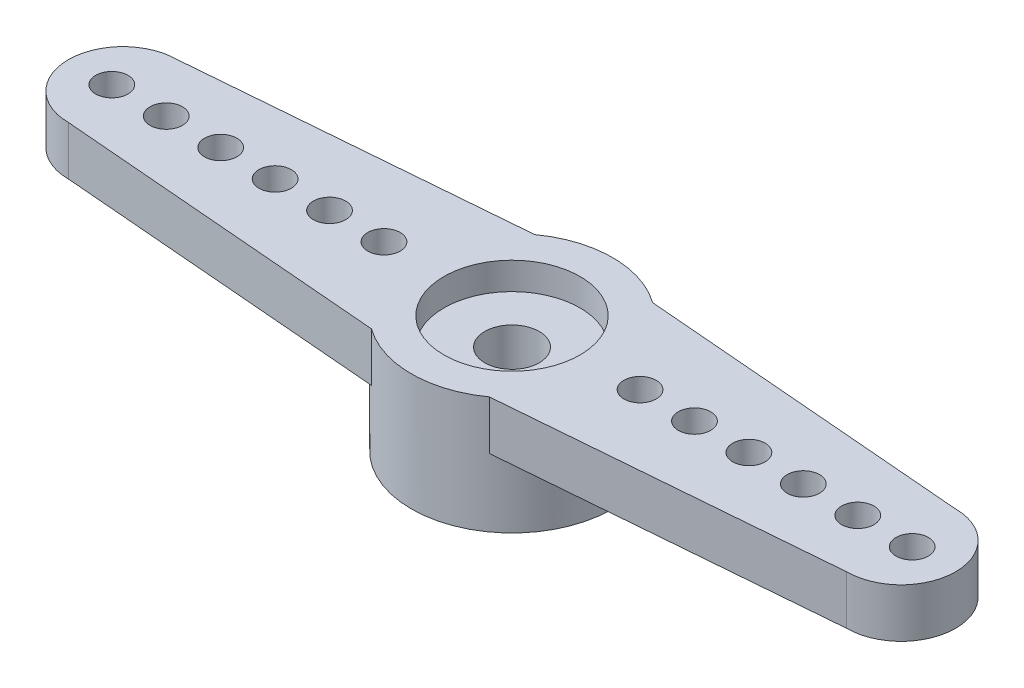
from build123d import *

# Parameters (mm, degrees)
CROQUIS1_R              = 3.7
SALIENTE_EXTRUIR2_DEPTH = 4.3
CROQUIS2_R              = 2.5
CORTAR_EXTRUIR1_DEPTH   = 1.5
CORTAR_EXTRUIR2_START   = -1
CROQUIS3_R              = 2.5
CORTAR_EXTRUIR2_DEPTH   = 1
CROQUIS4_R              = 1
CORTAR_EXTRUIR3_DEPTH   = 1.8
SALIENTE_EXTRUIR3_DEPTH = 1.8
CROQUIS6_R              = 0.595
CORTAR_EXTRUIR4_DEPTH   = 1.8


with BuildPart() as part:
    # Croquis1 → Saliente-Extruir2 (new body)
    with BuildSketch(Plane(origin=(0, 0, 0), x_dir=(1, 0, 0), z_dir=(0, 1, 0))):
        Circle(CROQUIS1_R)
    extrude(amount=SALIENTE_EXTRUIR2_DEPTH)

    # Croquis2 → Cortar-Extruir1 (cut)
    with BuildSketch(Plane.XZ):
        Circle(CROQUIS2_R)
    extrude(amount=-CORTAR_EXTRUIR1_DEPTH, mode=Mode.SUBTRACT)

    # Croquis3 → Cortar-Extruir2 (cut)
    with BuildSketch(Plane(origin=(0, 4.3, 0), x_dir=(1, 0, 0), z_dir=(0, 1, 0)).offset(CORTAR_EXTRUIR2_START)):
        Circle(CROQUIS3_R)
    extrude(amount=CORTAR_EXTRUIR2_DEPTH, mode=Mode.SUBTRACT)

    # Croquis4 → Cortar-Extruir3 (cut)
    with BuildSketch(Plane(origin=(0, 3.3, 0), x_dir=(1, 0, 0), z_dir=(0, 1, 0))):
        Circle(CROQUIS4_R)
    extrude(amount=-CORTAR_EXTRUIR3_DEPTH, mode=Mode.SUBTRACT)

    # Croquis5 → Saliente-Extruir3 (add)
    with BuildSketch(Plane(origin=(0, 4.3, 0), x_dir=(1, 0, 0), z_dir=(0, 1, 0))):
        with BuildLine():
            Line((-2.16564, 3.000000565), (-3.120237459, 0))
            Line((-3.120237459, 0), (-2.16564, -3.000000565))
            Line((-2.16564, -3.000000565), (-14.3, -2))
            ThreePointArc((-14.3, -2), (-16.3, 0), (-14.3, 2))
            Line((-14.3, 2), (-2.16564, 3.000000565))
        make_face()
        with BuildLine():
            Line((3.120237459, 0), (2.16564, -3.000000565))
            Line((2.16564, -3.000000565), (14.3, -2))
            ThreePointArc((14.3, -2), (16.3, 0), (14.3, 2))
            Line((14.3, 2), (2.16564, 3.000000565))
            Line((2.16564, 3.000000565), (3.120237459, 0))
        make_face()
    extrude(amount=-SALIENTE_EXTRUIR3_DEPTH)

    # Croquis6 → Cortar-Extruir4 (cut)
    with BuildSketch(Plane(origin=(0, 4.3, 0), x_dir=(1, 0, 0), z_dir=(0, 1, 0))):
        with Locations((-14.705, 0)):
            Circle(CROQUIS6_R)
        with Locations((-12.705, 0)):
            Circle(CROQUIS6_R)
        with Locations((-10.705, 0)):
            Circle(CROQUIS6_R)
        with Locations((-8.705, 0)):
            Circle(CROQUIS6_R)
        with Locations((-6.705, 0)):
            Circle(CROQUIS6_R)
        with Locations((-4.705, 0)):
            Circle(CROQUIS6_R)
        with Locations((14.705, 0)):
            Circle(CROQUIS6_R)
        with Locations((12.705, 0)):
            Circle(CROQUIS6_R)
        with Locations((10.705, 0)):
            Circle(CROQUIS6_R)
        with Locations((8.705, 0)):
            Circle(CROQUIS6_R)
        with Locations((6.705, 0)):
            Circle(CROQUIS6_R)
        with Locations((4.705, 0)):
            Circle(CROQUIS6_R)
    extrude(amount=-CORTAR_EXTRUIR4_DEPTH, mode=Mode.SUBTRACT)


solid = part.part
